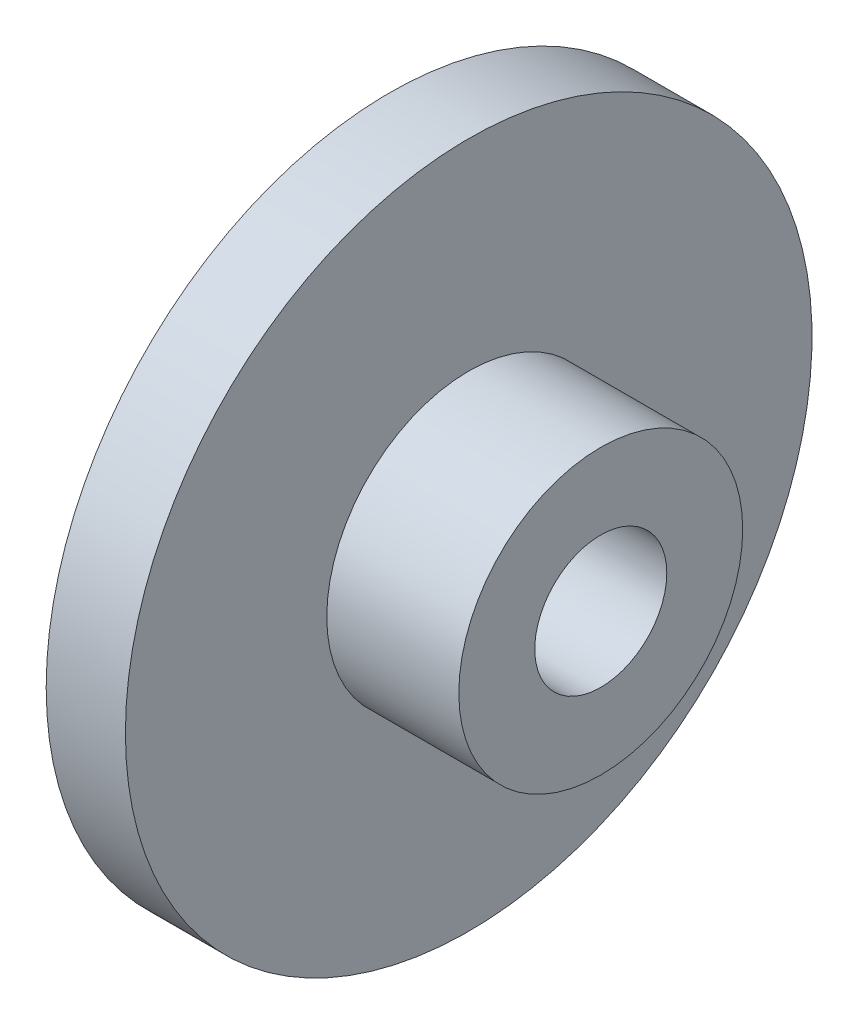
from build123d import *

# Parameters (mm, degrees)
SKETCH1_R                          = 20.6375
BOSS_EXTRUDE1_DEPTH                = 4.7625
SKETCH2_R                          = 8.5328125
BOSS_EXTRUDE2_DEPTH                = 7.9375
F_5_16_0_3125_DIAMETER_HOLE1_D     = 7.9375
F_5_16_0_3125_DIAMETER_HOLE1_DEPTH = 70.104
F_5_16_0_3125_DIAMETER_HOLE1_TIP   = 2.384665582


with BuildPart() as part:
    # Sketch1 → Boss-Extrude1 (new body)
    with BuildSketch(Plane(origin=(0, 0, 0), x_dir=(0, 0, -1), z_dir=(1, 0, 0))):
        Circle(SKETCH1_R)
    extrude(amount=BOSS_EXTRUDE1_DEPTH)

    # Sketch2 → Boss-Extrude2 (add)
    with BuildSketch(Plane(origin=(4.7625, 0, 0), x_dir=(0, 0, -1), z_dir=(1, 0, 0))):
        Circle(SKETCH2_R)
    extrude(amount=BOSS_EXTRUDE2_DEPTH)

    # 5/16 (0.3125) Diameter Hole1
    with Locations(Plane(origin=(12.7, 0, 0), x_dir=(0, 0, -1), z_dir=(1, 0, 0))):
        with Locations((0, 0)):
            Hole(F_5_16_0_3125_DIAMETER_HOLE1_D / 2, depth=F_5_16_0_3125_DIAMETER_HOLE1_DEPTH)
            with Locations((0, 0, -(F_5_16_0_3125_DIAMETER_HOLE1_DEPTH + F_5_16_0_3125_DIAMETER_HOLE1_TIP / 2))):  # 118° drill point
                Cone(0, F_5_16_0_3125_DIAMETER_HOLE1_D / 2, F_5_16_0_3125_DIAMETER_HOLE1_TIP, mode=Mode.SUBTRACT)


solid = part.part
